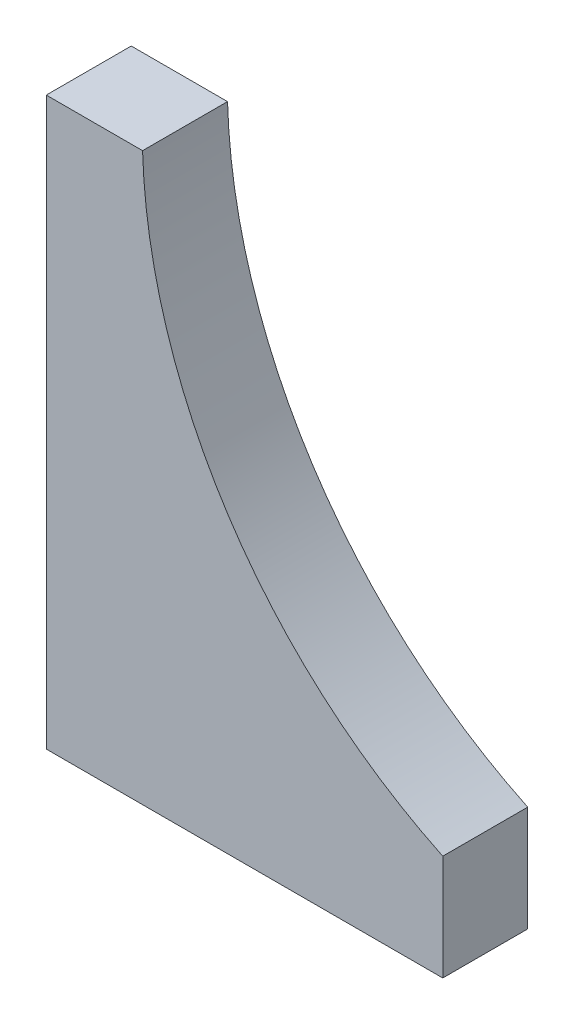
from build123d import *

# Parameters (mm, degrees)
BOSS_EXTRU_1_DEPTH      = 15
ESQUISSE7_R             = 2.5
ENL_V_MAT_EXTRU_4_DEPTH = 16
ESQUISSE5_R             = 2.5
ENL_V_MAT_EXTRU_5_DEPTH = 16
ESQUISSE8_R             = 2.5
ENL_V_MAT_EXTRU_6_DEPTH = 16
ESQUISSE9_R             = 2.5
ENL_V_MAT_EXTRU_7_DEPTH = 16


with BuildPart() as part:
    # Esquisse1 → Boss.-Extru.1 (new body)
    with BuildSketch(Plane.XY):
        with BuildLine():
            Line((0, 100), (17, 100))
            ThreePointArc((17, 100), (32.078733461, 51.873825012), (70, 18.625148861))
            Line((70, 18.625148861), (70, 0))
            Line((70, 0), (0, 0))
            Line((0, 0), (0, 100))
        make_face()
    extrude(amount=BOSS_EXTRU_1_DEPTH)

    # Esquisse7 → Enlèv. mat.-Extru.4 (cut)
    with BuildSketch(Plane.ZY):
        with Locations((7.5, 25)):
            Circle(ESQUISSE7_R)
    extrude(amount=-ENL_V_MAT_EXTRU_4_DEPTH, mode=Mode.SUBTRACT)

    # Esquisse5 → Enlèv. mat.-Extru.5 (cut)
    with BuildSketch(Plane.ZY):
        with Locations((7.5, 85)):
            Circle(ESQUISSE5_R)
    extrude(amount=-ENL_V_MAT_EXTRU_5_DEPTH, mode=Mode.SUBTRACT)

    # Esquisse8 → Enlèv. mat.-Extru.6 (cut)
    with BuildSketch(Plane.XZ):
        with Locations((20, 7.5)):
            Circle(ESQUISSE8_R)
    extrude(amount=-ENL_V_MAT_EXTRU_6_DEPTH, mode=Mode.SUBTRACT)

    # Esquisse9 → Enlèv. mat.-Extru.7 (cut)
    with BuildSketch(Plane.XZ):
        with Locations((55, 7.5)):
            Circle(ESQUISSE9_R)
    extrude(amount=-ENL_V_MAT_EXTRU_7_DEPTH, mode=Mode.SUBTRACT)


solid = part.part
